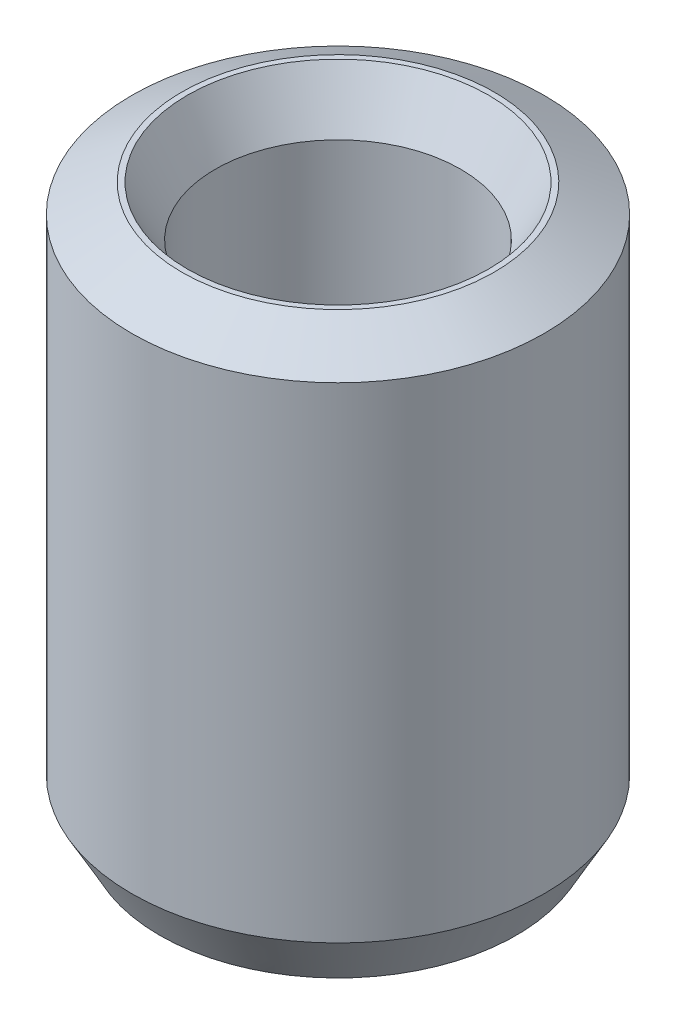
from build123d import *
from OCP.BRepFilletAPI import BRepFilletAPI_MakeChamfer

# Parameters (mm, degrees)
SKETCH1_R           = 12.5
BOSS_EXTRUDE1_DEPTH = 34.135975978
SKETCH2_R           = 7.434374499
CUT_EXTRUDE1_DEPTH  = 39.441707246
CHAMFER1_SIZE       = 1.694207143
CHAMFER1_SIZE2      = 3.035806902


with BuildPart() as part:
    # Sketch1 → Boss-Extrude1 (new body)
    with BuildSketch(Plane(origin=(0, 0, 0), x_dir=(1, 0, 0), z_dir=(0, 1, 0))):
        Circle(SKETCH1_R)
    extrude(amount=BOSS_EXTRUDE1_DEPTH)

    # Sketch2 → Cut-Extrude1 (cut, through all)
    with BuildSketch(Plane(origin=(0, 0, 0), x_dir=(1, 0, 0), z_dir=(0, 1, 0))):
        Circle(SKETCH2_R)
    extrude(amount=CUT_EXTRUDE1_DEPTH, mode=Mode.SUBTRACT)

    # Chamfer1: one chamfer whose edges measure the first distance from different faces: ONE call of the kernel's chamfer builder (chamfer() names one face for all edges)
    chamfer1_edges_1 = [part.edges().sort_by_distance(p)[0] for p in [
        (-7.434374499, 34.135975978, 0),
    ]]
    chamfer1_side_1 = [part.faces().sort_by_distance(p)[0] for p in [
        (-12.146446609, 34.135975978, 0),
    ]]
    chamfer1_edges_2 = [part.edges().sort_by_distance(p)[0] for p in [
        (-7.434374499, 0, 0),
    ]]
    chamfer1_side_2 = [part.faces().sort_by_distance(p)[0] for p in [
        (-7.434374499, 17.067987989, 0),
    ]]
    chamfer1_edges_3 = [part.edges().sort_by_distance(p)[0] for p in [
        (-12.5, 0, 0),
    ]]
    chamfer1_side_3 = [part.faces().sort_by_distance(p)[0] for p in [
        (-12.146446609, 0, 0),
    ]]
    chamfer1_edges_4 = [part.edges().sort_by_distance(p)[0] for p in [
        (-12.5, 34.135975978, 0),
    ]]
    chamfer1_side_4 = [part.faces().sort_by_distance(p)[0] for p in [
        (-12.5, 17.067987989, 0),
    ]]
    chamfer1 = BRepFilletAPI_MakeChamfer(part.part.solid().wrapped)
    for e in chamfer1_edges_1:
        chamfer1.Add(CHAMFER1_SIZE, CHAMFER1_SIZE2, e.wrapped, chamfer1_side_1[0].wrapped)  # the first distance lies on this face
    for e in chamfer1_edges_2:
        chamfer1.Add(CHAMFER1_SIZE, CHAMFER1_SIZE2, e.wrapped, chamfer1_side_2[0].wrapped)  # the first distance lies on this face
    for e in chamfer1_edges_3:
        chamfer1.Add(CHAMFER1_SIZE, CHAMFER1_SIZE2, e.wrapped, chamfer1_side_3[0].wrapped)  # the first distance lies on this face
    for e in chamfer1_edges_4:
        chamfer1.Add(CHAMFER1_SIZE, CHAMFER1_SIZE2, e.wrapped, chamfer1_side_4[0].wrapped)  # the first distance lies on this face
    add(Compound.cast(chamfer1.Shape()), mode=Mode.REPLACE)


solid = part.part
